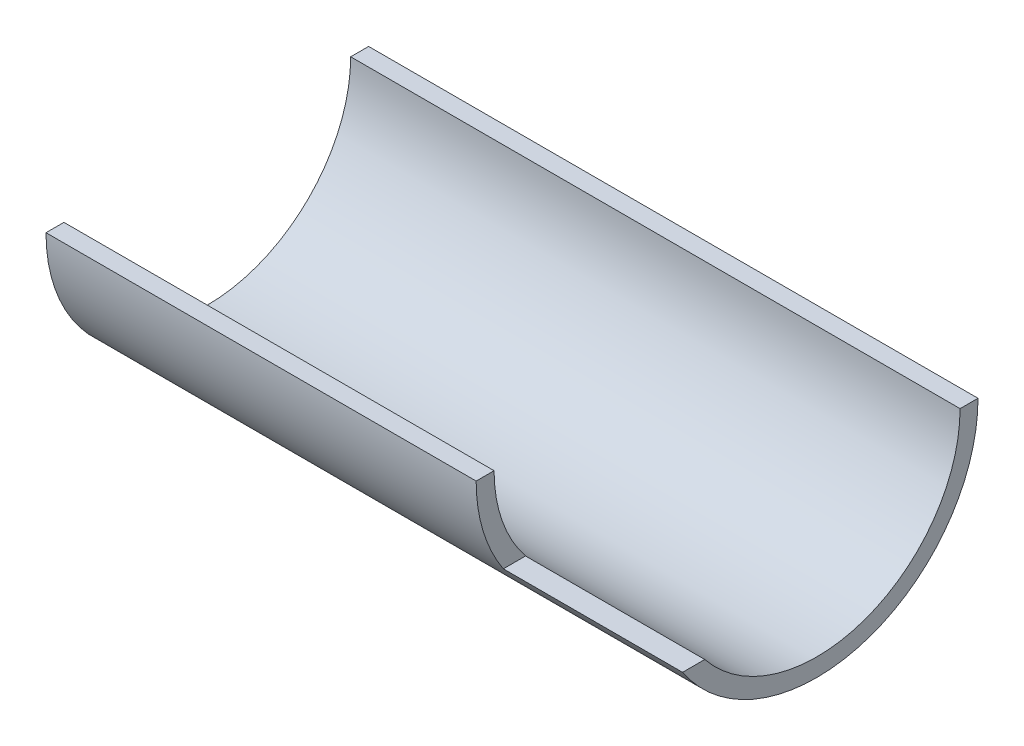
from build123d import *

# Parameters (mm, degrees)
BOSS_EXTRUDE1_DEPTH = 107.95
SKETCH2_W           = 31.75
SKETCH2_H           = 15.875
CUT_EXTRUDE1_DEPTH  = 127
SKETCH3_OUTSIDE_W   = 91.34
SKETCH3_OUTSIDE_H   = 59.59
SKETCH3_OUTSIDE_R   = 28.575
CUT_EXTRUDE2_DEPTH  = 117.915899261


with BuildPart() as part:
    # Sketch1 → Boss-Extrude1 (new body)
    with BuildSketch(Plane(origin=(0, 0, 0), x_dir=(0, 0, -1), z_dir=(1, 0, 0))):
        with BuildLine():
            Line((-25.4, 0), (-31.75, 0))
            ThreePointArc((-31.75, 0), (0, -31.75), (31.75, 0))
            Line((31.75, 0), (25.4, 0))
            ThreePointArc((25.4, 0), (0, -25.4), (-25.4, 0))
        make_face()
    extrude(amount=-BOSS_EXTRUDE1_DEPTH)

    # Sketch2 → Cut-Extrude1 (cut)
    with BuildSketch(Plane.XY):
        with Locations((-15.875, -7.9375)):
            Rectangle(SKETCH2_W, SKETCH2_H)
    extrude(amount=CUT_EXTRUDE1_DEPTH, mode=Mode.SUBTRACT)

    # Sketch3 outside → Cut-Extrude2 (cut, through all)
    with BuildSketch(Plane(origin=(0, 0, 0), x_dir=(0, 0, -1), z_dir=(1, 0, 0))):
        with Locations((0, -15.875)):
            Rectangle(SKETCH3_OUTSIDE_W, SKETCH3_OUTSIDE_H)
        Circle(SKETCH3_OUTSIDE_R, mode=Mode.SUBTRACT)
    extrude(amount=-CUT_EXTRUDE2_DEPTH, mode=Mode.SUBTRACT)


solid = part.part
